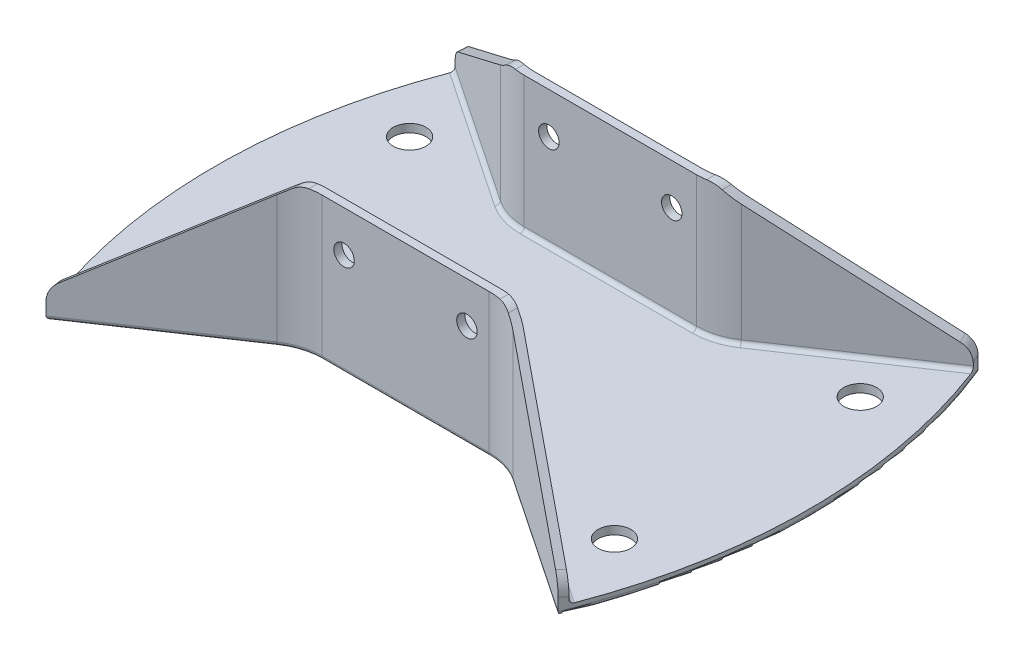
from build123d import *

# Parameters (mm, degrees)
SKETCH1_W               = 145
SKETCH1_H               = 102.5
BOSS_EXTRUDE1_DEPTH     = 35
SKETCH2_OUTSIDE_W       = 183.198
SKETCH2_OUTSIDE_H       = 140.698
CUT_EXTRUDE1_DEPTH      = 35
CUT_EXTRUDE2_DEPTH      = 33
CUT_EXTRUDE6_DEPTH      = 96.434859983
CUT_EXTRUDE6_DEPTH_BACK = 96.434859983
SKETCH6_R               = 2.5
FILLET1_R               = 5
FILLET3_R               = 15
FILLET2_R               = 1
CUT_EXTRUDE8_REACH      = 96.72
SKETCH7_R               = 4


with BuildPart() as part:
    # Sketch1 → Boss-Extrude1 (new body)
    with BuildSketch(Plane(origin=(0, 0, 0), x_dir=(1, 0, 0), z_dir=(0, 1, 0))):
        Rectangle(SKETCH1_W, SKETCH1_H)
    extrude(amount=BOSS_EXTRUDE1_DEPTH)

    # Sketch2 outside → Cut-Extrude1 (cut)
    with BuildSketch(Plane(origin=(0, 35, 0), x_dir=(1, 0, 0), z_dir=(0, 1, 0))):
        Rectangle(SKETCH2_OUTSIDE_W, SKETCH2_OUTSIDE_H)
        with BuildLine():
            Line((-25, 26), (25, 26))
            Line((25, 26), (62.5, 51.25))
            ThreePointArc((62.5, 51.25), (72.5, 0), (62.5, -51.25))
            Line((62.5, -51.25), (25, -26))
            Line((25, -26), (-25, -26))
            Line((-25, -26), (-62.5, -51.25))
            ThreePointArc((-62.5, -51.25), (-72.5, 0), (-62.5, 51.25))
            Line((-62.5, 51.25), (-25, 26))
        make_face(mode=Mode.SUBTRACT)
    extrude(amount=-CUT_EXTRUDE1_DEPTH, mode=Mode.SUBTRACT)

    # Sketch3 → Cut-Extrude2 (cut)
    with BuildSketch(Plane(origin=(0, 35, 0), x_dir=(1, 0, 0), z_dir=(0, 1, 0))):
        Polygon((-80, 60.622210958), (-80, -60.622210958), (-25.610577786, -24), (25.610577786, -24), (80, -60.622210958), (80, 60.622210958), (25.610577786, 24), (-25.610577786, 24), align=None)
    extrude(amount=-CUT_EXTRUDE2_DEPTH, mode=Mode.SUBTRACT)

    # Sketch6 → Cut-Extrude6 (cut, two sides: drawn at the far end of the back side and taken through both)
    with BuildSketch(Plane.XY.offset(-CUT_EXTRUDE6_DEPTH_BACK)):
        with Locations((-15, 25)):
            Circle(SKETCH6_R)
        with Locations((15, 25)):
            Circle(SKETCH6_R)
        Polygon((-65, 5), (-25, 35), (25, 35), (65, 5), (65, 40), (-65, 40), align=None)
    extrude(amount=CUT_EXTRUDE6_DEPTH + CUT_EXTRUDE6_DEPTH_BACK, mode=Mode.SUBTRACT)

    # Fillet1
    fillet1_edges = [part.edges().sort_by_distance(p)[0] for p in [
        (62.880951883, 6.589286088, -50.300770386),
        (62.880951883, 6.589286088, 50.300770386),
        (25, 35, 25),
        (25, 35, -25),
        (-25, 35, -25),
        (-25, 35, 25),
        (-62.880951883, 6.589286088, -50.300770386),
        (-62.880951883, 6.589286088, 50.300770386),
    ]]
    fillet(fillet1_edges, radius=FILLET1_R)

    # Fillet3
    fillet3_edges = [part.edges().sort_by_distance(p)[0] for p in [
        (25, 17.357022604, -26),
        (25, 17.357022604, 26),
        (-25, 17.357022604, 26),
        (-25, 17.357022604, -26),
    ]]
    fillet(fillet3_edges, radius=FILLET3_R)
    fillet3_2_edges = [part.edges().sort_by_distance(p)[0] for p in [
        (25.610577786, 18.225654831, 24),
        (25.610577786, 18.225654831, -24),
        (-25.610577786, 18.225654831, 24),
        (-25.610577786, 18.225654831, -24),
    ]]
    fillet(fillet3_2_edges, radius=FILLET3_R)

    # Fillet2
    fillet2_edges = [part.edges().sort_by_distance(p)[0] for p in [
        (45.649253825, 0, 39.903830909),
        (72.5, 0, 0),
        (45.649253825, 0, -39.903830909),
        (0, 0, -26),
        (-45.649253825, 0, -39.903830909),
        (-72.5, 0, 0),
        (-45.649253825, 0, 39.903830909),
        (0, 0, 26),
        (-46.332177592, 2, 37.952543869),
        (0, 2, 24),
        (46.332177592, 2, 37.952543869),
        (46.332177592, 2, -37.952543869),
        (0, 2, -24),
        (-46.332177592, 2, -37.952543869),
        (-25.411023339, 2, 24.653657735),
        (25.411023339, 2, 24.653657735),
        (25.411023339, 2, -24.653657735),
        (-25.411023339, 2, -24.653657735),
        (24.800445554, 0, 26.653657735),
        (24.800445554, 0, -26.653657735),
        (-24.800445554, 0, -26.653657735),
        (-24.800445554, 0, 26.653657735),
    ]]
    fillet(fillet2_edges, radius=FILLET2_R)

    # Sketch7 → Cut-Extrude8 (cut, up to next)
    with BuildSketch(Plane(origin=(0, 2, 0), x_dir=(1, 0, 0), z_dir=(0, 1, 0)), mode=Mode.PRIVATE) as cut_extrude8_sk1:
        with Locations((55, 30)):
            Circle(SKETCH7_R)
    cut_extrude8_tool1 = extrude(cut_extrude8_sk1.sketch, amount=-CUT_EXTRUDE8_REACH, mode=Mode.PRIVATE) & part.part
    # Sketch7 → Cut-Extrude8 (cut, up to next)
    with BuildSketch(Plane(origin=(0, 2, 0), x_dir=(1, 0, 0), z_dir=(0, 1, 0)), mode=Mode.PRIVATE) as cut_extrude8_sk2:
        with Locations((55, -30)):
            Circle(SKETCH7_R)
    cut_extrude8_tool2 = extrude(cut_extrude8_sk2.sketch, amount=-CUT_EXTRUDE8_REACH, mode=Mode.PRIVATE) & part.part
    # Sketch7 → Cut-Extrude8 (cut, up to next)
    with BuildSketch(Plane(origin=(0, 2, 0), x_dir=(1, 0, 0), z_dir=(0, 1, 0)), mode=Mode.PRIVATE) as cut_extrude8_sk3:
        with Locations((-55, -30)):
            Circle(SKETCH7_R)
    cut_extrude8_tool3 = extrude(cut_extrude8_sk3.sketch, amount=-CUT_EXTRUDE8_REACH, mode=Mode.PRIVATE) & part.part
    # Sketch7 → Cut-Extrude8 (cut, up to next)
    with BuildSketch(Plane(origin=(0, 2, 0), x_dir=(1, 0, 0), z_dir=(0, 1, 0)), mode=Mode.PRIVATE) as cut_extrude8_sk4:
        with Locations((-55, 30)):
            Circle(SKETCH7_R)
    cut_extrude8_tool4 = extrude(cut_extrude8_sk4.sketch, amount=-CUT_EXTRUDE8_REACH, mode=Mode.PRIVATE) & part.part
    add(cut_extrude8_tool1.solids().sort_by_distance((55, 2, -30))[0], mode=Mode.SUBTRACT)
    add(cut_extrude8_tool2.solids().sort_by_distance((55, 2, 30))[0], mode=Mode.SUBTRACT)
    add(cut_extrude8_tool3.solids().sort_by_distance((-55, 2, 30))[0], mode=Mode.SUBTRACT)
    add(cut_extrude8_tool4.solids().sort_by_distance((-55, 2, -30))[0], mode=Mode.SUBTRACT)


solid = part.part
